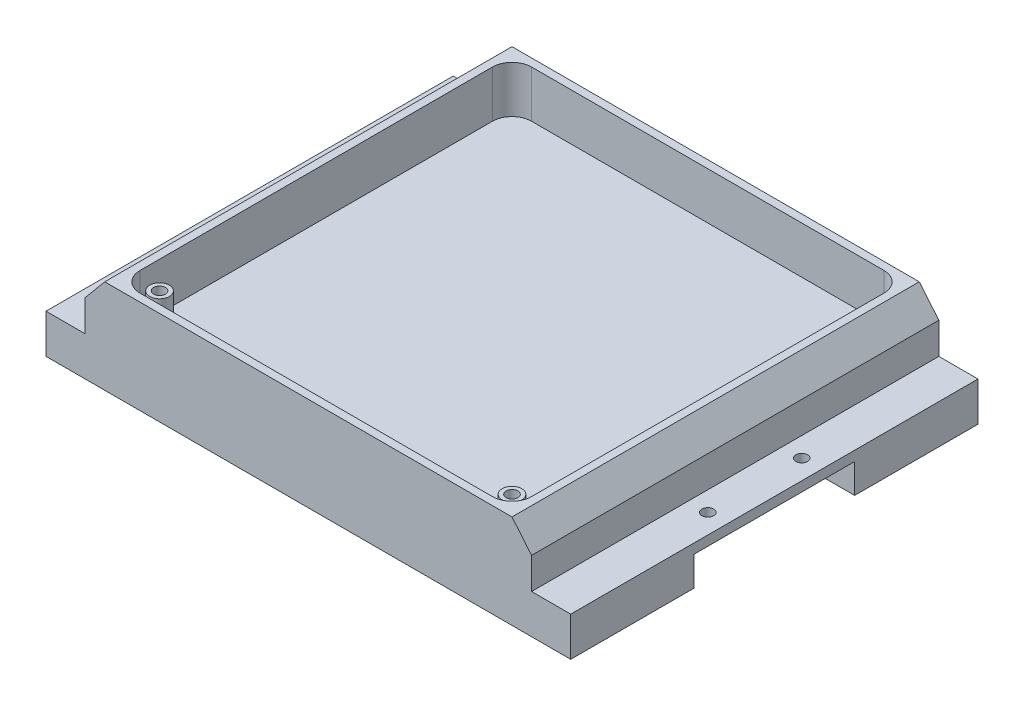
from build123d import *

# Parameters (mm, degrees)
BOSS_EXTRUDE3_DEPTH  = 12
BOSS_EXTRUDE5_DEPTH  = 12
BOSS_EXTRUDE6_DEPTH  = 12
BOSS_EXTRUDE7_DEPTH  = 12
SKETCH13_W           = 102
SKETCH13_H           = 12
BOSS_EXTRUDE11_DEPTH = 1
SKETCH14_W           = 103
SKETCH14_H           = 12
BOSS_EXTRUDE12_DEPTH = 1
SKETCH15_W           = 103
SKETCH15_H           = 12
BOSS_EXTRUDE13_DEPTH = 1
SKETCH16_W           = 104
SKETCH16_H           = 12
BOSS_EXTRUDE14_DEPTH = 1
SKETCH17_W           = 104
SKETCH17_H           = 104
BOSS_EXTRUDE16_DEPTH = 12
SKETCH18_R           = 2.5
SKETCH18_R_2         = 1.5
BOSS_EXTRUDE18_DEPTH = 10
SKETCH19_R           = 2.5
SKETCH19_R_2         = 1.5
BOSS_EXTRUDE19_DEPTH = 10
SKETCH20_W           = 104
SKETCH20_H           = 24
BOSS_EXTRUDE20_DEPTH = 10
CUT_EXTRUDE2_DEPTH   = 104
SKETCH23_W           = 104
SKETCH23_H           = 24
BOSS_EXTRUDE21_DEPTH = 10
CUT_EXTRUDE3_DEPTH   = 104
SKETCH26_W           = 10
SKETCH26_H           = 41
CUT_EXTRUDE5_DEPTH   = 7.5
SKETCH29_W           = 5
SKETCH29_H           = 104
CUT_EXTRUDE6_DEPTH   = 8
SKETCH30_W           = 5
SKETCH30_H           = 104
CUT_EXTRUDE7_DEPTH   = 8
BOSS_EXTRUDE22_DEPTH = 5
SKETCH33_W           = 41
SKETCH33_H           = 7.5
BOSS_EXTRUDE23_DEPTH = 5
BOSS_EXTRUDE24_DEPTH = 5
SKETCH35_W           = 41
SKETCH35_H           = 7.5
BOSS_EXTRUDE25_DEPTH = 5
SKETCH36_R           = 1.5
CUT_EXTRUDE8_DEPTH   = 2.5
SKETCH37_R           = 1.5
CUT_EXTRUDE9_DEPTH   = 2.5


with BuildPart() as part:
    # Sketch1 → Boss-Extrude3 (new body)
    with BuildSketch(Plane(origin=(0, 0, 0), x_dir=(1, 0, 0), z_dir=(0, 1, 0))):
        with BuildLine():
            Line((-46, 51), (46, 51))
            ThreePointArc((46, 51), (49.535533906, 49.535533906), (51, 46))
            Line((51, 46), (51, -46))
            ThreePointArc((51, -46), (49.535533906, -49.535533906), (46, -51))
            Line((46, -51), (-46, -51))
            ThreePointArc((-46, -51), (-49.535533906, -49.535533906), (-51, -46))
            Line((-51, -46), (-51, 46))
            ThreePointArc((-51, 46), (-49.535533906, 49.535533906), (-46, 51))
        make_face()
    extrude(amount=BOSS_EXTRUDE3_DEPTH)

    # Sketch4 → Boss-Extrude5 (add)
    with BuildSketch(Plane(origin=(0, 0, 0), x_dir=(-1, 0, 0), z_dir=(0, -1, 0))):
        with BuildLine():
            Line((-46, -51), (-51, -51))
            Line((-51, -51), (-51, -46))
            ThreePointArc((-51, -46), (-49.535533906, -49.535533906), (-46, -51))
        make_face()
    extrude(amount=-BOSS_EXTRUDE5_DEPTH)

    # Sketch6 → Boss-Extrude6 (add)
    with BuildSketch(Plane.XZ):
        with BuildLine():
            Line((-51, -46), (-51, -51))
            Line((-51, -51), (-46, -51))
            ThreePointArc((-46, -51), (-49.535533906, -49.535533906), (-51, -46))
        make_face()
    extrude(amount=-BOSS_EXTRUDE6_DEPTH)

    # Sketch7 → Boss-Extrude7 (add)
    with BuildSketch(Plane.XZ):
        with BuildLine():
            Line((-46, 51), (-51, 51))
            Line((-51, 51), (-51, 46))
            ThreePointArc((-51, 46), (-49.535533906, 49.535533906), (-46, 51))
        make_face()
        with BuildLine():
            Line((46, -51), (51, -51))
            Line((51, -51), (51, -46))
            ThreePointArc((51, -46), (49.535533906, -49.535533906), (46, -51))
        make_face()
    extrude(amount=-BOSS_EXTRUDE7_DEPTH)

    # Sketch13 → Boss-Extrude11 (add)
    with BuildSketch(Plane.XY.offset(51)):
        with Locations((0, 6)):
            Rectangle(SKETCH13_W, SKETCH13_H)
    extrude(amount=BOSS_EXTRUDE11_DEPTH)

    # Sketch14 → Boss-Extrude12 (add)
    with BuildSketch(Plane(origin=(51, 0, 0), x_dir=(0, 0, -1), z_dir=(1, 0, 0))):
        with Locations((-0.5, 6)):
            Rectangle(SKETCH14_W, SKETCH14_H)
    extrude(amount=BOSS_EXTRUDE12_DEPTH)

    # Sketch15 → Boss-Extrude13 (add)
    with BuildSketch(Plane(origin=(0, 0, -51), x_dir=(-1, 0, 0), z_dir=(0, 0, -1))):
        with Locations((-0.5, 6)):
            Rectangle(SKETCH15_W, SKETCH15_H)
    extrude(amount=BOSS_EXTRUDE13_DEPTH)

    # Sketch16 → Boss-Extrude14 (add)
    with BuildSketch(Plane.ZY.offset(51)):
        with Locations((0, 6)):
            Rectangle(SKETCH16_W, SKETCH16_H)
    extrude(amount=BOSS_EXTRUDE14_DEPTH)

    # Sketch17 → Boss-Extrude16 (add)
    with BuildSketch(Plane(origin=(0, 12, 0), x_dir=(1, 0, 0), z_dir=(0, 1, 0))):
        Rectangle(SKETCH17_W, SKETCH17_H)
        with BuildLine():
            Line((-45, 50), (45, 50))
            ThreePointArc((45, 50), (48.535533906, 48.535533906), (50, 45))
            Line((50, 45), (50, -45))
            ThreePointArc((50, -45), (48.535533906, -48.535533906), (45, -50))
            Line((45, -50), (-45, -50))
            ThreePointArc((-45, -50), (-48.535533906, -48.535533906), (-50, -45))
            Line((-50, -45), (-50, 45))
            ThreePointArc((-50, 45), (-48.535533906, 48.535533906), (-45, 50))
        make_face(mode=Mode.SUBTRACT)
    extrude(amount=BOSS_EXTRUDE16_DEPTH)

    # Sketch18 → Boss-Extrude18 (add)
    with BuildSketch(Plane(origin=(0, 12, 0), x_dir=(1, 0, 0), z_dir=(0, 1, 0))):
        with Locations((45, -45)):
            Circle(SKETCH18_R)
        with Locations((45, -45)):
            Circle(SKETCH18_R_2, mode=Mode.SUBTRACT)
    extrude(amount=BOSS_EXTRUDE18_DEPTH)

    # Sketch19 → Boss-Extrude19 (add)
    with BuildSketch(Plane(origin=(0, 12, 0), x_dir=(1, 0, 0), z_dir=(0, 1, 0))):
        with Locations((-45, -45)):
            Circle(SKETCH19_R)
        with Locations((-45, -45)):
            Circle(SKETCH19_R_2, mode=Mode.SUBTRACT)
    extrude(amount=BOSS_EXTRUDE19_DEPTH)

    # Sketch20 → Boss-Extrude20 (add)
    with BuildSketch(Plane(origin=(52, 0, 0), x_dir=(0, 0, -1), z_dir=(1, 0, 0))):
        with Locations((0, 12)):
            Rectangle(SKETCH20_W, SKETCH20_H)
    extrude(amount=BOSS_EXTRUDE20_DEPTH)

    # Sketch21 → Cut-Extrude2 (cut)
    with BuildSketch(Plane.XY.offset(52)):
        Polygon((62, 24), (52, 24), (57, 18), (62, 18), align=None)
    extrude(amount=-CUT_EXTRUDE2_DEPTH, mode=Mode.SUBTRACT)

    # Sketch23 → Boss-Extrude21 (add)
    with BuildSketch(Plane.ZY.offset(52)):
        with Locations((0, 12)):
            Rectangle(SKETCH23_W, SKETCH23_H)
    extrude(amount=BOSS_EXTRUDE21_DEPTH)

    # Sketch24 → Cut-Extrude3 (cut)
    with BuildSketch(Plane.XY.offset(52)):
        Polygon((-62, 24), (-52, 24), (-57, 18), (-62, 18), align=None)
    extrude(amount=-CUT_EXTRUDE3_DEPTH, mode=Mode.SUBTRACT)

    # Sketch26 → Cut-Extrude5 (cut)
    with BuildSketch(Plane.XZ):
        with Locations((-57, 0)):
            Rectangle(SKETCH26_W, SKETCH26_H)
        with Locations((57, 0)):
            Rectangle(SKETCH26_W, SKETCH26_H)
    extrude(amount=-CUT_EXTRUDE5_DEPTH, mode=Mode.SUBTRACT)

    # Sketch29 → Cut-Extrude6 (cut)
    with BuildSketch(Plane(origin=(0, 18, 0), x_dir=(1, 0, 0), z_dir=(0, 1, 0))):
        with Locations((59.5, 0)):
            Rectangle(SKETCH29_W, SKETCH29_H)
    extrude(amount=-CUT_EXTRUDE6_DEPTH, mode=Mode.SUBTRACT)

    # Sketch30 → Cut-Extrude7 (cut)
    with BuildSketch(Plane(origin=(0, 18, 0), x_dir=(1, 0, 0), z_dir=(0, 1, 0))):
        with Locations((-59.5, 0)):
            Rectangle(SKETCH30_W, SKETCH30_H)
    extrude(amount=-CUT_EXTRUDE7_DEPTH, mode=Mode.SUBTRACT)

    # Sketch32 → Boss-Extrude22 (add)
    with BuildSketch(Plane.ZY.offset(62)):
        Polygon((-52, 10), (-52, 0), (-20.5, 0), (-20.5, 7.5), (20.5, 7.5), (20.5, 0), (52, 0), (52, 10), align=None)
    extrude(amount=BOSS_EXTRUDE22_DEPTH)

    # Sketch33 → Boss-Extrude23 (add)
    with BuildSketch(Plane.ZY.offset(52)):
        with Locations((0, 3.75)):
            Rectangle(SKETCH33_W, SKETCH33_H)
    extrude(amount=BOSS_EXTRUDE23_DEPTH)

    # Sketch34 → Boss-Extrude24 (add)
    with BuildSketch(Plane(origin=(62, 0, 0), x_dir=(0, 0, -1), z_dir=(1, 0, 0))):
        Polygon((-52, 10), (-52, 0), (-20.5, 0), (-20.5, 7.5), (20.5, 7.5), (20.5, 0), (52, 0), (52, 10), align=None)
    extrude(amount=BOSS_EXTRUDE24_DEPTH)

    # Sketch35 → Boss-Extrude25 (add)
    with BuildSketch(Plane(origin=(52, 0, 0), x_dir=(0, 0, -1), z_dir=(1, 0, 0))):
        with Locations((0, 3.75)):
            Rectangle(SKETCH35_W, SKETCH35_H)
    extrude(amount=BOSS_EXTRUDE25_DEPTH)

    # Sketch36 → Cut-Extrude8 (cut)
    with BuildSketch(Plane.XZ.offset(-7.5)):
        with Locations((62, 12)):
            Circle(SKETCH36_R)
        with Locations((62, -12)):
            Circle(SKETCH36_R)
    extrude(amount=-CUT_EXTRUDE8_DEPTH, mode=Mode.SUBTRACT)

    # Sketch37 → Cut-Extrude9 (cut)
    with BuildSketch(Plane.XZ.offset(-7.5)):
        with Locations((-62, 12)):
            Circle(SKETCH37_R)
        with Locations((-62, -12)):
            Circle(SKETCH37_R)
    extrude(amount=-CUT_EXTRUDE9_DEPTH, mode=Mode.SUBTRACT)


solid = part.part
